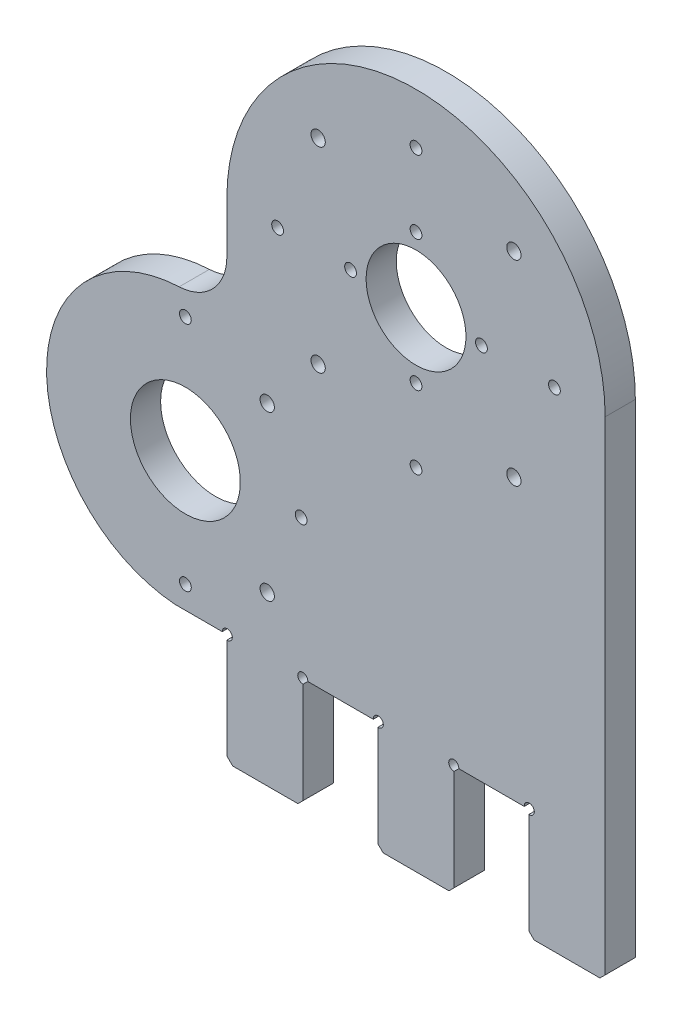
from build123d import *

# Parameters (mm, degrees)
SKETCH1_R              = 11
SKETCH1_R_2            = 10
SKETCH1_R_3            = 1.25
SKETCH1_R_4            = 1.5
BOSS_EXTRUDE1_DEPTH    = 6
SKETCH2_W              = 15
SKETCH2_H              = 22
BOSS_EXTRUDE2_DEPTH    = 6
CHAMFER1_SIZE          = 1
SKETCH3_R              = 1
CUT_EXTRUDE1_DEPTH     = 159.031622749
FILLET1_R              = 10
MOVE_FACE1_OUTLINE_R   = 11
MOVE_FACE1_OUTLINE_R_2 = 10.92
MOVE_FACE1_OUTLINE_R_3 = 10
MOVE_FACE1_OUTLINE_R_4 = 9.92
MOVE_FACE1_OUTLINE_R_5 = 1.25
MOVE_FACE1_OUTLINE_R_6 = 1.17
MOVE_FACE1_OUTLINE_R_7 = 1.5
MOVE_FACE1_OUTLINE_R_8 = 1.42
MOVE_FACE1_DEPTH       = 6


# Read off the part's stored shape, not the designer's step: Move Face1
with BuildPart() as part:
    # Sketch1 → Boss-Extrude1 (new body)
    with BuildSketch(Plane.XY):
        with BuildLine():
            Line((-40.498784978, 0), (0, 0))
            Line((0, 0), (0, 75))
            ThreePointArc((0, 75), (-37.5, 112.5), (-75, 75))
            Line((-75, 75), (-75, 55))
            Line((-75, 55), (-83.323029145, 55))
            ThreePointArc((-83.323029145, 55), (-110.823029145, 27.5), (-83.323029145, 0))
            Line((-83.323029145, 0), (-40.498784978, 0))
        make_face()
        with Locations((-83.323029145, 27.5)):
            Circle(SKETCH1_R, mode=Mode.SUBTRACT)
        with Locations((-37.5, 75)):
            Circle(SKETCH1_R_2, mode=Mode.SUBTRACT)
        with Locations((-83.323029145, 50.5)):
            Circle(SKETCH1_R_3, mode=Mode.SUBTRACT)
        with Locations((-67.059573177, 43.763455967)):
            Circle(SKETCH1_R_4, mode=Mode.SUBTRACT)
        with Locations((-37.5, 102.5)):
            Circle(SKETCH1_R_3, mode=Mode.SUBTRACT)
        with Locations((-10, 75)):
            Circle(SKETCH1_R_3, mode=Mode.SUBTRACT)
        with Locations((-37.5, 47.5)):
            Circle(SKETCH1_R_3, mode=Mode.SUBTRACT)
        with Locations((-65, 75)):
            Circle(SKETCH1_R_3, mode=Mode.SUBTRACT)
        with Locations((-56.945436483, 94.445436483)):
            Circle(SKETCH1_R_4, mode=Mode.SUBTRACT)
        with Locations((-60.323029145, 27.5)):
            Circle(SKETCH1_R_3, mode=Mode.SUBTRACT)
        with Locations((-67.059573177, 11.236544033)):
            Circle(SKETCH1_R_4, mode=Mode.SUBTRACT)
        with Locations((-83.323029145, 4.5)):
            Circle(SKETCH1_R_3, mode=Mode.SUBTRACT)
        with Locations((-18.054563517, 94.445436483)):
            Circle(SKETCH1_R_4, mode=Mode.SUBTRACT)
        with Locations((-18.054563517, 55.554563517)):
            Circle(SKETCH1_R_4, mode=Mode.SUBTRACT)
        with Locations((-56.945436483, 55.554563517)):
            Circle(SKETCH1_R_4, mode=Mode.SUBTRACT)
        with Locations((-37.5, 88)):
            Circle(SKETCH1_R_3, mode=Mode.SUBTRACT)
        with Locations((-50.5, 75)):
            Circle(SKETCH1_R_3, mode=Mode.SUBTRACT)
        with Locations((-37.5, 62)):
            Circle(SKETCH1_R_3, mode=Mode.SUBTRACT)
        with Locations((-24.5, 75)):
            Circle(SKETCH1_R_3, mode=Mode.SUBTRACT)
    extrude(amount=BOSS_EXTRUDE1_DEPTH)

    # Sketch2 → Boss-Extrude2 (add)
    with BuildSketch(Plane(origin=(0, 0, 0), x_dir=(-1, 0, 0), z_dir=(0, 0, -1))):
        with Locations((7.5, -11)):
            Rectangle(SKETCH2_W, SKETCH2_H)
        with Locations((37.5, -11)):
            Rectangle(SKETCH2_W, SKETCH2_H)
        with Locations((67.5, -11)):
            Rectangle(SKETCH2_W, SKETCH2_H)
    extrude(amount=-BOSS_EXTRUDE2_DEPTH)

    # Chamfer1
    chamfer1_edges = [part.edges().sort_by_distance(p)[0] for p in [
        (0, -22, 3),
        (-15, -22, 3),
        (-30, -22, 3),
        (-45, -22, 3),
        (-60, -22, 3),
        (-75, -22, 3),
    ]]
    chamfer(chamfer1_edges, length=CHAMFER1_SIZE)

    # Sketch3 → Cut-Extrude1 (cut, through all)
    with BuildSketch(Plane.XY.offset(6)):
        with Locations((-75, 0)):
            Circle(SKETCH3_R)
        with Locations((-60, 0)):
            Circle(SKETCH3_R)
        with Locations((-45, 0)):
            Circle(SKETCH3_R)
        with Locations((-30, 0)):
            Circle(SKETCH3_R)
        with Locations((-15, 0)):
            Circle(SKETCH3_R)
    extrude(amount=-CUT_EXTRUDE1_DEPTH, mode=Mode.SUBTRACT)

    # Fillet1
    fillet1_edges = [part.edges().sort_by_distance(p)[0] for p in [
        (-75, 55, 3),
    ]]
    fillet(fillet1_edges, radius=FILLET1_R)

    # Move Face1 outline → Move Face1 (add)
    # profile 1 of 25: a face of its own
    with BuildSketch(Plane.XY):
        with BuildLine():
            Line((-59.003205136, -0.08), (-45.996794864, -0.08))
            ThreePointArc((-45.996794864, -0.08), (-45.999198395, -0.04003209), (-46, 0))
            Line((-46, 0), (-59, 0))
            ThreePointArc((-59, 0), (-59.000801605, -0.04003209), (-59.003205136, -0.08))
        make_face()
    # profile 2 of 25: a face of its own
    with BuildSketch(Plane.XY):
        with BuildLine():
            Line((-45, -21), (-45, -1))
            ThreePointArc((-45, -1), (-45.04003209, -0.999198395), (-45.08, -0.996794864))
            Line((-45.08, -0.996794864), (-45.08, -21.033137085))
            Line((-45.08, -21.033137085), (-44.033137085, -22.08))
            Line((-44.033137085, -22.08), (-30.966862915, -22.08))
            Line((-30.966862915, -22.08), (-29.92, -21.033137085))
            Line((-29.92, -21.033137085), (-29.92, -0.996794864))
            ThreePointArc((-29.92, -0.996794864), (-29.95996791, -0.999198395), (-30, -1))
            Line((-30, -1), (-30, -21))
            Line((-30, -21), (-31, -22))
            Line((-31, -22), (-44, -22))
            Line((-44, -22), (-45, -21))
        make_face()
    # profile 3 of 25: a face of its own
    with BuildSketch(Plane.XY):
        with BuildLine():
            ThreePointArc((-59.92, -0.996794864), (-59.95996791, -0.999198395), (-60, -1))
            Line((-60, -1), (-60, -21))
            Line((-60, -21), (-61, -22))
            Line((-61, -22), (-74, -22))
            Line((-74, -22), (-73.92, -22.08))
            Line((-73.92, -22.08), (-60.966862915, -22.08))
            Line((-60.966862915, -22.08), (-59.92, -21.033137085))
            Line((-59.92, -21.033137085), (-59.92, -0.996794864))
        make_face()
    # profile 4 of 25: a face of its own
    with BuildSketch(Plane.XY):
        with BuildLine():
            Line((-75.08, -20.92), (-75, -21))
            Line((-75, -21), (-75, -1))
            ThreePointArc((-75, -1), (-75.04003209, -0.999198395), (-75.08, -0.996794864))
            Line((-75.08, -0.996794864), (-75.08, -20.92))
        make_face()
    # profile 5 of 25: a face of its own
    with BuildSketch(Plane.XY):
        with BuildLine():
            Line((-16, 0), (-29, 0))
            ThreePointArc((-29, 0), (-29.000801605, -0.04003209), (-29.003205136, -0.08))
            Line((-29.003205136, -0.08), (-15.996794864, -0.08))
            ThreePointArc((-15.996794864, -0.08), (-15.999198395, -0.04003209), (-16, 0))
        make_face()
    # profile 6 of 25: a face of its own
    with BuildSketch(Plane.XY):
        with BuildLine():
            Line((-85.422171827, 0), (-83.323029145, 0))
            ThreePointArc((-83.323029145, 0), (-110.816150501, 26.884956844), (-84.552807772, 54.972488867))
            ThreePointArc((-84.552807772, 54.972488867), (-77.772555006, 58.051331596), (-75, 64.962484818))
            Line((-75, 64.962484818), (-75, 75))
            ThreePointArc((-75, 75), (-37.5, 112.5), (0, 75))
            Line((0, 75), (0, -21))
            Line((0, -21), (-1, -22))
            Line((-1, -22), (-14, -22))
            Line((-14, -22), (-15, -21))
            Line((-15, -21), (-15, -1))
            ThreePointArc((-15, -1), (-15.04003209, -0.999198395), (-15.08, -0.996794864))
            Line((-15.08, -0.996794864), (-15.08, -21.033137085))
            Line((-15.08, -21.033137085), (-14.033137085, -22.08))
            Line((-14.033137085, -22.08), (-0.966862915, -22.08))
            Line((-0.966862915, -22.08), (0.08, -21.033137085))
            Line((0.08, -21.033137085), (0.08, 75))
            ThreePointArc((0.08, 75), (-37.5, 112.58), (-75.08, 75))
            Line((-75.08, 75), (-75.08, 64.962484818))
            ThreePointArc((-75.08, 64.962484818), (-77.830374566, 58.106620822), (-84.55638531, 55.052408834))
            ThreePointArc((-84.55638531, 55.052408834), (-110.899619158, 27.933685652), (-85.422171827, 0))
        make_face()
    # profile 7 of 25: a face of its own
    with BuildSketch(Plane.XY):
        with Locations((-83.323029145, 27.5)):
            Circle(MOVE_FACE1_OUTLINE_R)
        with Locations((-83.323029145, 27.5)):
            Circle(MOVE_FACE1_OUTLINE_R_2, mode=Mode.SUBTRACT)
    # profile 8 of 25: a face of its own
    with BuildSketch(Plane.XY):
        with Locations((-37.5, 75)):
            Circle(MOVE_FACE1_OUTLINE_R_3)
        with Locations((-37.5, 75)):
            Circle(MOVE_FACE1_OUTLINE_R_4, mode=Mode.SUBTRACT)
    # profile 9 of 25: a face of its own
    with BuildSketch(Plane.XY):
        with Locations((-83.323029145, 50.5)):
            Circle(MOVE_FACE1_OUTLINE_R_5)
        with Locations((-83.323029145, 50.5)):
            Circle(MOVE_FACE1_OUTLINE_R_6, mode=Mode.SUBTRACT)
    # profile 10 of 25: a face of its own
    with BuildSketch(Plane.XY):
        with Locations((-67.059573177, 43.763455967)):
            Circle(MOVE_FACE1_OUTLINE_R_7)
        with Locations((-67.059573177, 43.763455967)):
            Circle(MOVE_FACE1_OUTLINE_R_8, mode=Mode.SUBTRACT)
    # profile 11 of 25: a face of its own
    with BuildSketch(Plane.XY):
        with Locations((-37.5, 102.5)):
            Circle(MOVE_FACE1_OUTLINE_R_5)
        with Locations((-37.5, 102.5)):
            Circle(MOVE_FACE1_OUTLINE_R_6, mode=Mode.SUBTRACT)
    # profile 12 of 25: a face of its own
    with BuildSketch(Plane.XY):
        with Locations((-10, 75)):
            Circle(MOVE_FACE1_OUTLINE_R_5)
        with Locations((-10, 75)):
            Circle(MOVE_FACE1_OUTLINE_R_6, mode=Mode.SUBTRACT)
    # profile 13 of 25: a face of its own
    with BuildSketch(Plane.XY):
        with Locations((-37.5, 47.5)):
            Circle(MOVE_FACE1_OUTLINE_R_5)
        with Locations((-37.5, 47.5)):
            Circle(MOVE_FACE1_OUTLINE_R_6, mode=Mode.SUBTRACT)
    # profile 14 of 25: a face of its own
    with BuildSketch(Plane.XY):
        with Locations((-65, 75)):
            Circle(MOVE_FACE1_OUTLINE_R_5)
        with Locations((-65, 75)):
            Circle(MOVE_FACE1_OUTLINE_R_6, mode=Mode.SUBTRACT)
    # profile 15 of 25: a face of its own
    with BuildSketch(Plane.XY):
        with Locations((-56.945436483, 94.445436483)):
            Circle(MOVE_FACE1_OUTLINE_R_7)
        with Locations((-56.945436483, 94.445436483)):
            Circle(MOVE_FACE1_OUTLINE_R_8, mode=Mode.SUBTRACT)
    # profile 16 of 25: a face of its own
    with BuildSketch(Plane.XY):
        with Locations((-37.5, 88)):
            Circle(MOVE_FACE1_OUTLINE_R_5)
        with Locations((-37.5, 88)):
            Circle(MOVE_FACE1_OUTLINE_R_6, mode=Mode.SUBTRACT)
    # profile 17 of 25: a face of its own
    with BuildSketch(Plane.XY):
        with Locations((-60.323029145, 27.5)):
            Circle(MOVE_FACE1_OUTLINE_R_5)
        with Locations((-60.323029145, 27.5)):
            Circle(MOVE_FACE1_OUTLINE_R_6, mode=Mode.SUBTRACT)
    # profile 18 of 25: a face of its own
    with BuildSketch(Plane.XY):
        with Locations((-67.059573177, 11.236544033)):
            Circle(MOVE_FACE1_OUTLINE_R_7)
        with Locations((-67.059573177, 11.236544033)):
            Circle(MOVE_FACE1_OUTLINE_R_8, mode=Mode.SUBTRACT)
    # profile 19 of 25: a face of its own
    with BuildSketch(Plane.XY):
        with Locations((-83.323029145, 4.5)):
            Circle(MOVE_FACE1_OUTLINE_R_5)
        with Locations((-83.323029145, 4.5)):
            Circle(MOVE_FACE1_OUTLINE_R_6, mode=Mode.SUBTRACT)
    # profile 20 of 25: a face of its own
    with BuildSketch(Plane.XY):
        with Locations((-18.054563517, 94.445436483)):
            Circle(MOVE_FACE1_OUTLINE_R_7)
        with Locations((-18.054563517, 94.445436483)):
            Circle(MOVE_FACE1_OUTLINE_R_8, mode=Mode.SUBTRACT)
    # profile 21 of 25: a face of its own
    with BuildSketch(Plane.XY):
        with Locations((-18.054563517, 55.554563517)):
            Circle(MOVE_FACE1_OUTLINE_R_7)
        with Locations((-18.054563517, 55.554563517)):
            Circle(MOVE_FACE1_OUTLINE_R_8, mode=Mode.SUBTRACT)
    # profile 22 of 25: a face of its own
    with BuildSketch(Plane.XY):
        with Locations((-56.945436483, 55.554563517)):
            Circle(MOVE_FACE1_OUTLINE_R_7)
        with Locations((-56.945436483, 55.554563517)):
            Circle(MOVE_FACE1_OUTLINE_R_8, mode=Mode.SUBTRACT)
    # profile 23 of 25: a face of its own
    with BuildSketch(Plane.XY):
        with Locations((-50.5, 75)):
            Circle(MOVE_FACE1_OUTLINE_R_5)
        with Locations((-50.5, 75)):
            Circle(MOVE_FACE1_OUTLINE_R_6, mode=Mode.SUBTRACT)
    # profile 24 of 25: a face of its own
    with BuildSketch(Plane.XY):
        with Locations((-37.5, 62)):
            Circle(MOVE_FACE1_OUTLINE_R_5)
        with Locations((-37.5, 62)):
            Circle(MOVE_FACE1_OUTLINE_R_6, mode=Mode.SUBTRACT)
    # profile 25 of 25: a face of its own
    with BuildSketch(Plane.XY):
        with Locations((-24.5, 75)):
            Circle(MOVE_FACE1_OUTLINE_R_5)
        with Locations((-24.5, 75)):
            Circle(MOVE_FACE1_OUTLINE_R_6, mode=Mode.SUBTRACT)
    extrude(amount=MOVE_FACE1_DEPTH)


solid = part.part
